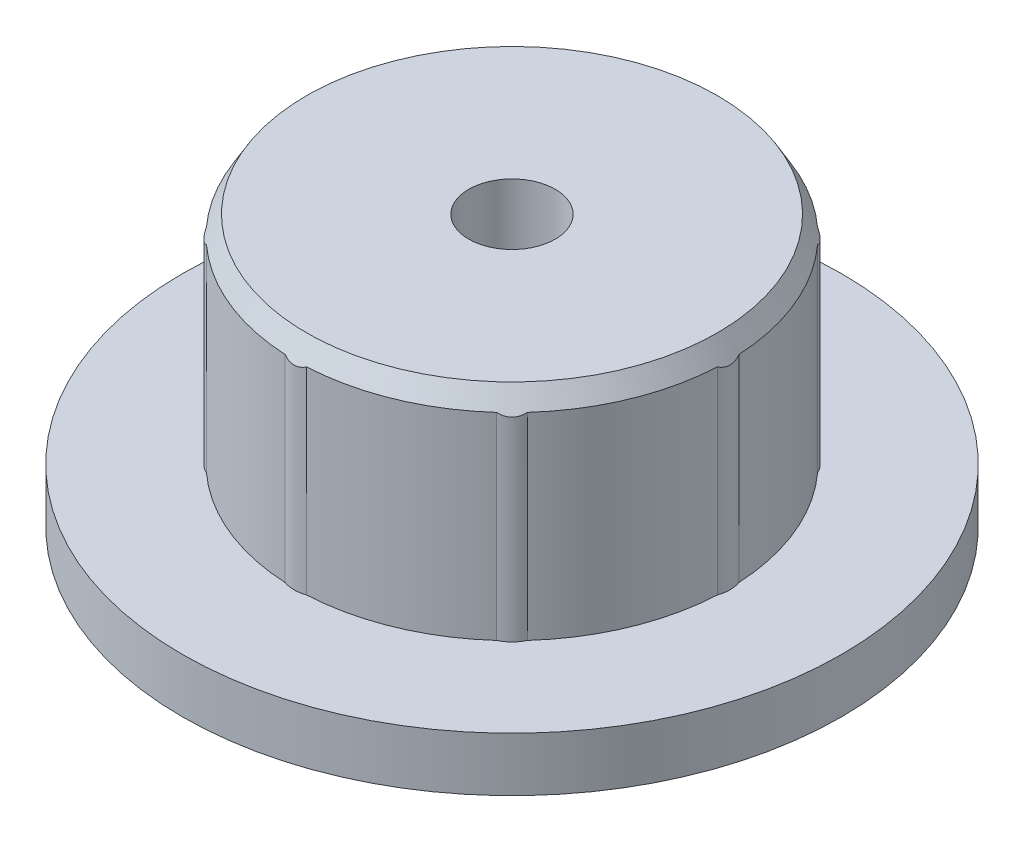
from build123d import *

# Parameters (mm, degrees)
BOSS_EXTRUDE1_DEPTH = 20
SKETCH3_R           = 30.48
BOSS_EXTRUDE2_DEPTH = 5
SKETCH11_R          = 4
CUT_EXTRUDE2_DEPTH  = 50.830320087


with BuildPart() as part:
    # Sketch1 → Boss-Extrude1 (new body)
    with BuildSketch(Plane(origin=(0, 0, 0), x_dir=(1, 0, 0), z_dir=(0, 1, 0))):
        with BuildLine():
            ThreePointArc((-1, 19.974984355), (-7.653668647, 18.47759065), (-13.417340111, 14.831553673))
            ThreePointArc((-13.417340111, 14.831553673), (-14.248201641, 14.248201641), (-14.831553673, 13.417340111))
            ThreePointArc((-14.831553673, 13.417340111), (-18.47759065, 7.653668647), (-19.974984355, 1))
            ThreePointArc((-19.974984355, 1), (-20.15, 0), (-19.974984355, -1))
            ThreePointArc((-19.974984355, -1), (-18.47759065, -7.653668647), (-14.831553673, -13.417340111))
            ThreePointArc((-14.831553673, -13.417340111), (-14.248201641, -14.248201641), (-13.417340111, -14.831553673))
            ThreePointArc((-13.417340111, -14.831553673), (-7.653668647, -18.47759065), (-1, -19.974984355))
            ThreePointArc((-1, -19.974984355), (0, -20.15), (1, -19.974984355))
            ThreePointArc((1, -19.974984355), (7.653668647, -18.47759065), (13.417340111, -14.831553673))
            ThreePointArc((13.417340111, -14.831553673), (14.248201641, -14.248201641), (14.831553673, -13.417340111))
            ThreePointArc((14.831553673, -13.417340111), (18.47759065, -7.653668647), (19.974984355, -1))
            ThreePointArc((19.974984355, -1), (20.15, 0), (19.974984355, 1))
            ThreePointArc((19.974984355, 1), (18.47759065, 7.653668647), (14.831553673, 13.417340111))
            ThreePointArc((14.831553673, 13.417340111), (14.248201641, 14.248201641), (13.417340111, 14.831553673))
            ThreePointArc((13.417340111, 14.831553673), (7.653668647, 18.47759065), (1, 19.974984355))
            ThreePointArc((1, 19.974984355), (0, 20.15), (-1, 19.974984355))
        make_face()
    extrude(amount=BOSS_EXTRUDE1_DEPTH)

    # Sketch2 → Cut-Revolve1 (revolve, cut)
    with BuildSketch(Plane.XY):
        Polygon((-18.56228676, 20.75), (-20.724984355, 17.004097883), (-20.724984355, 20.75), align=None)
    revolve(axis=Axis((0, 0, 0), (0, 1, 0)), mode=Mode.SUBTRACT)

    # Sketch3 → Boss-Extrude2 (add)
    with BuildSketch(Plane.XZ):
        Circle(SKETCH3_R)
    extrude(amount=BOSS_EXTRUDE2_DEPTH)

    # Sketch11 → Cut-Extrude2 (cut, through all)
    with BuildSketch(Plane(origin=(0, 20, 0), x_dir=(1, 0, 0), z_dir=(0, 1, 0))):
        Circle(SKETCH11_R)
    extrude(amount=-CUT_EXTRUDE2_DEPTH, mode=Mode.SUBTRACT)


solid = part.part
